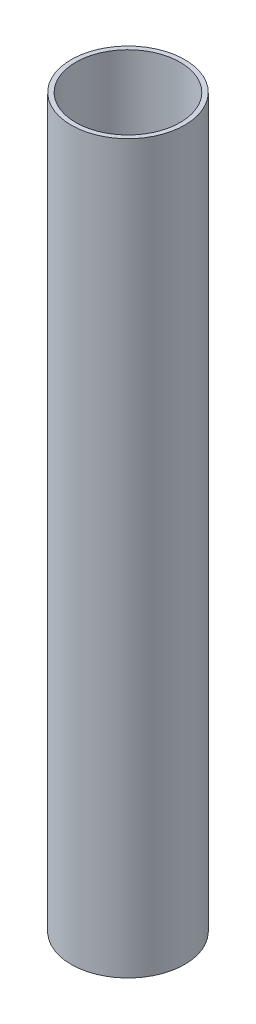
from build123d import *

# Parameters (mm, degrees)
SKETCH_1_R      = 25
SKETCH_1_R_2    = 23
EXTRUDE_1_DEPTH = 320


with BuildPart() as part:
    # Эскиз1 → Бобышка-Вытянуть1 (new body)
    with BuildSketch(Plane(origin=(0, 0, 0), x_dir=(1, 0, 0), z_dir=(0, 1, 0))):
        Circle(SKETCH_1_R)
        Circle(SKETCH_1_R_2, mode=Mode.SUBTRACT)
    extrude(amount=EXTRUDE_1_DEPTH)


solid = part.part
